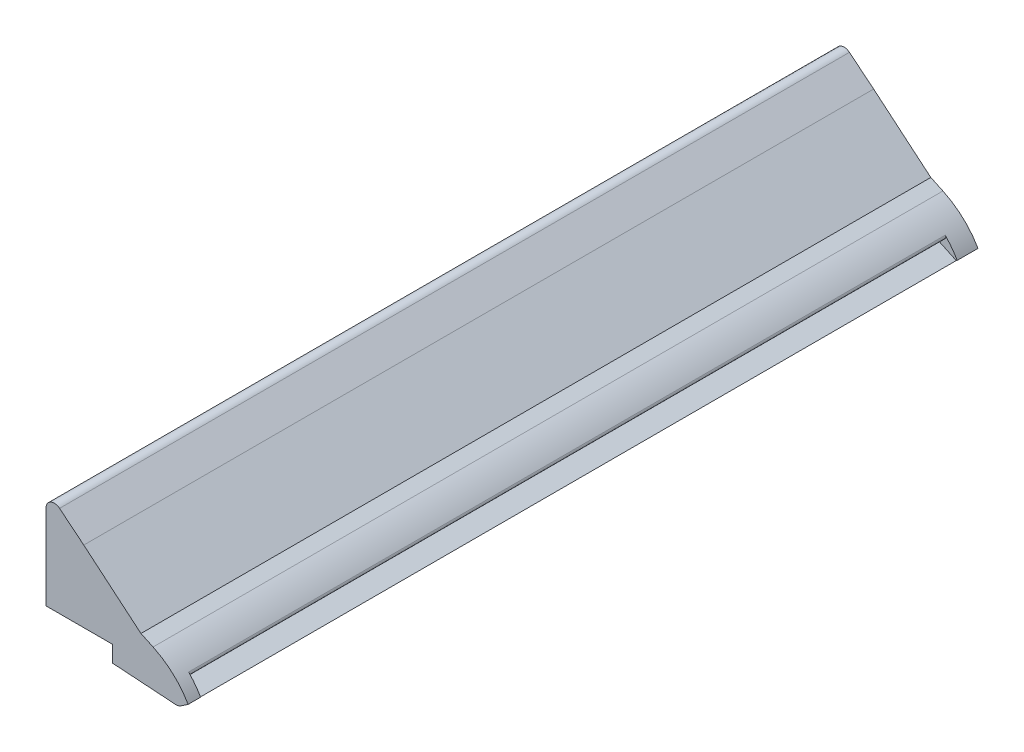
from build123d import *

# Parameters (mm, degrees)
BOSS_EXTRUDE1_DEPTH = 190
CUT_EXTRUDE1_START  = 5
CUT_EXTRUDE1_DEPTH  = 182
FILLET3_START       = -1
FILLET3_DEPTH       = 192
CUT_EXTRUDE3_DEPTH  = 203
FILLET4_R           = 0.5
FILLET5_R           = 2
FILLET6_R           = 2


with BuildPart() as part:
    # Sketch1 → Boss-Extrude1 (new body)
    with BuildSketch(Plane.XY):
        Polygon((0, 0), (19, 0), (19, 5), (6.83805717, 10.67120708), (-6.91649822, 22.212649435), (-16, 29.600046382), (-16, 12.189630226), (-16, 5), (0, 5), align=None)
    extrude(amount=BOSS_EXTRUDE1_DEPTH)

    # Sketch2 → Cut-Extrude1 (cut)
    with BuildSketch(Plane.XY.offset(CUT_EXTRUDE1_START)):
        Polygon((21.633927393, 1.359461681), (3.507771652, 9.811826915), (2.873844259, 8.452365235), (21, 0), align=None)
    extrude(amount=CUT_EXTRUDE1_DEPTH, mode=Mode.SUBTRACT)

    # Fillet3: read off the stored shape, not the designer's step
    # Fillet3 outline → Fillet3 (cut)
    with BuildSketch(Plane.XY.offset(FILLET3_START)):
        with BuildLine():
            Line((19, 5), (9.753768459, 9.311588577))
            ThreePointArc((9.753768459, 9.311588577), (15.206282278, 5.479370881), (19, 0))
            Line((19, 0), (19, 5))
        make_face()
    extrude(amount=FILLET3_DEPTH, mode=Mode.SUBTRACT)

    # Sketch6 → Cut-Extrude3 (cut)
    with BuildSketch(Plane.XY.offset(190)):
        Polygon((0, 1.071241245), (15.85883014, 0), (18.190743079, 1.570510584), (20.776431757, 1.395851019), (18.077940116, -2.328162287), (-1.219539475, -1.555674607), (-2.427097473, 0.237321984), align=None)
    extrude(amount=-CUT_EXTRUDE3_DEPTH, mode=Mode.SUBTRACT)

    # Fillet4
    fillet4_edges = [part.edges().sort_by_distance(p)[0] for p in [
        (16.849447034, 3.590501512, 96),
    ]]
    fillet(fillet4_edges, radius=FILLET4_R)

    # Fillet5
    fillet5_edges = [part.edges().sort_by_distance(p)[0] for p in [
        (15.85883014, 0, 95),
    ]]
    fillet(fillet5_edges, radius=FILLET5_R)

    # Fillet6
    fillet6_edges = [part.edges().sort_by_distance(p)[0] for p in [
        (-16, 29.600046382, 95),
    ]]
    fillet(fillet6_edges, radius=FILLET6_R)


solid = part.part
